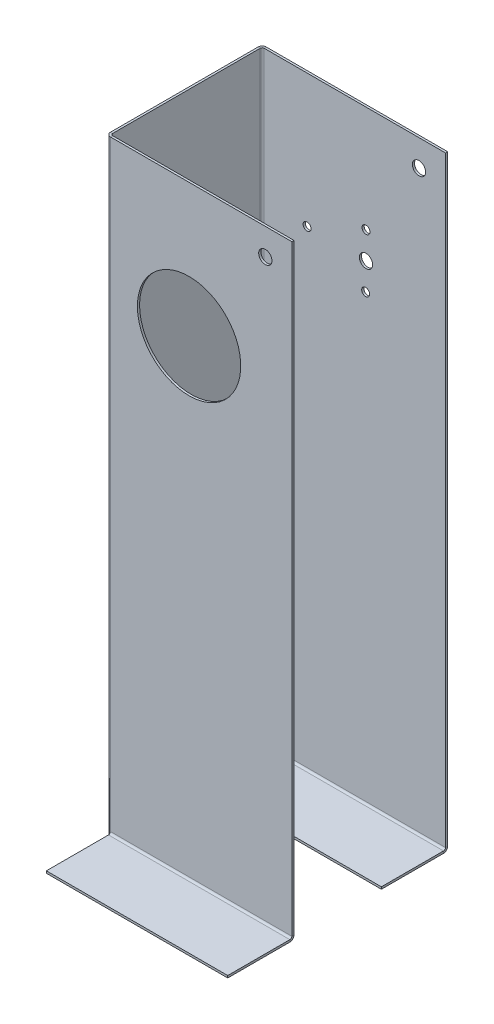
from build123d import *

# Parameters (mm, degrees)
SKETCH1_W                      = 70
SKETCH1_H                      = 228.6
BASE_FLANGE1_DEPTH             = 0.81
EDGE_FLANGE1_STRIP_W           = 4.7132
EDGE_FLANGE1_STRIP_H           = 0.81
EDGE_FLANGE1_STRIP_CUT_DEPTH   = 228.6
EDGE_FLANGE1_DEPTH             = 228.6
EDGE_FLANGE2_STRIP_W           = 4.7132
EDGE_FLANGE2_STRIP_H           = 0.81
EDGE_FLANGE2_STRIP_CUT_DEPTH   = 228.6
EDGE_FLANGE2_DEPTH             = 228.6
EDGE_FLANGE3_STRIP_W           = 4.7132
EDGE_FLANGE3_STRIP_H           = 0.81
EDGE_FLANGE3_STRIP_CUT_DEPTH   = 68.4534
EDGE_FLANGE3_STRIP_2_W         = 4.7132
EDGE_FLANGE3_STRIP_2_H         = 0.81
EDGE_FLANGE3_STRIP_CUT_2_DEPTH = 68.4534
EDGE_FLANGE3_DEPTH             = 68.4534
EDGE_FLANGE3_BEND_DEPTH        = 68.4534
CUT_EXTRUDE2_REACH             = 255.075
SKETCH18_R                     = 2.5
SKETCH18_R_2                   = 1.5
CUT_EXTRUDE1_REACH             = 248.204
SKETCH17_R                     = 19.5
SKETCH17_R_2                   = 2.5


# Sheet-metal steps are written as plain solids
with BuildPart() as part:
    # Sketch1 → Base-Flange1 (new body)
    with BuildSketch(Plane.XY):
        with Locations((35, 114.3)):
            Rectangle(SKETCH1_W, SKETCH1_H)
    extrude(amount=-BASE_FLANGE1_DEPTH)

    # Edge-Flange1 strip (across the edge) → Edge-Flange1 strip cut (cut)
    with BuildSketch(Plane(origin=(0, 0, -0.81), x_dir=(1, 0, 0), z_dir=(0, 1, 0))):
        with Locations((-0.81, -0.405)):
            Rectangle(EDGE_FLANGE1_STRIP_W, EDGE_FLANGE1_STRIP_H)
    extrude(amount=EDGE_FLANGE1_STRIP_CUT_DEPTH, mode=Mode.SUBTRACT)

    # Edge-Flange1 section (across the edge) → Edge-Flange1 (add)
    with BuildSketch(Plane(origin=(0, 0, -0.81), x_dir=(1, 0, 0), z_dir=(0, 1, 0))):
        with BuildLine():
            Line((0, 0.7366), (0, 58))
            Line((0, 58), (0.81, 58))
            Line((0.81, 58), (0.81, 0.7366))
            ThreePointArc((0.81, 0.7366), (1.025745145, 0.215745145), (1.5466, 0))
            Line((1.5466, 0), (1.5466, -0.81))
            ThreePointArc((1.5466, -0.81), (0.452988652, -0.357011348), (0, 0.7366))
        make_face()
    extrude(amount=EDGE_FLANGE1_DEPTH)

    # Edge-Flange2 strip (across the edge) → Edge-Flange2 strip cut (cut)
    with BuildSketch(Plane(origin=(0.81, 0, -58.81), x_dir=(0, 0, 1), z_dir=(0, 1, 0))):
        with Locations((-0.81, -0.405)):
            Rectangle(EDGE_FLANGE2_STRIP_W, EDGE_FLANGE2_STRIP_H)
    extrude(amount=EDGE_FLANGE2_STRIP_CUT_DEPTH, mode=Mode.SUBTRACT)

    # Edge-Flange2 section (across the edge) → Edge-Flange2 (add)
    with BuildSketch(Plane(origin=(0.81, 0, -58.81), x_dir=(0, 0, 1), z_dir=(0, 1, 0))):
        with BuildLine():
            Line((0, 0.7366), (0, 69.19))
            Line((0, 69.19), (0.81, 69.19))
            Line((0.81, 69.19), (0.81, 0.7366))
            ThreePointArc((0.81, 0.7366), (1.025745145, 0.215745145), (1.5466, 0))
            Line((1.5466, 0), (1.5466, -0.81))
            ThreePointArc((1.5466, -0.81), (0.452988652, -0.357011348), (0, 0.7366))
        make_face()
    extrude(amount=EDGE_FLANGE2_DEPTH)

    # Edge-Flange3 strip (across the edge) → Edge-Flange3 strip cut (cut)
    with BuildSketch(Plane.YZ.offset(1.5466)):
        with Locations((-0.81, -0.405)):
            Rectangle(EDGE_FLANGE3_STRIP_W, EDGE_FLANGE3_STRIP_H)
    extrude(amount=EDGE_FLANGE3_STRIP_CUT_DEPTH, mode=Mode.SUBTRACT)

    # Edge-Flange3 strip 2 (across the edge) → Edge-Flange3 strip cut 2 (cut)
    with BuildSketch(Plane(origin=(1.5466, 0, -58), x_dir=(0, 1, 0), z_dir=(1, 0, 0))):
        with Locations((-0.81, -0.405)):
            Rectangle(EDGE_FLANGE3_STRIP_2_W, EDGE_FLANGE3_STRIP_2_H)
    extrude(amount=EDGE_FLANGE3_STRIP_CUT_2_DEPTH, mode=Mode.SUBTRACT)

    # Edge-Flange3 section (across the edge) → Edge-Flange3 (add)
    with BuildSketch(Plane.YZ.offset(1.5466)):
        with BuildLine():
            Line((0, 0.7366), (0, 24.19))
            Line((0, 24.19), (0.81, 24.19))
            Line((0.81, 24.19), (0.81, 0.7366))
            ThreePointArc((0.81, 0.7366), (1.025745145, 0.215745145), (1.5466, 0))
            Line((1.5466, 0), (1.5466, -0.81))
            ThreePointArc((1.5466, -0.81), (0.452988652, -0.357011348), (0, 0.7366))
        make_face()
    extrude(amount=EDGE_FLANGE3_DEPTH)

    # Edge-Flange3 section 2 (across the edge) → Edge-Flange3 bend (add)
    with BuildSketch(Plane(origin=(1.5466, 0, -58), x_dir=(0, 1, 0), z_dir=(1, 0, 0))):
        with BuildLine():
            Line((0, 0.7366), (0, 24.19))
            Line((0, 24.19), (0.81, 24.19))
            Line((0.81, 24.19), (0.81, 0.7366))
            ThreePointArc((0.81, 0.7366), (1.025745145, 0.215745145), (1.5466, 0))
            Line((1.5466, 0), (1.5466, -0.81))
            ThreePointArc((1.5466, -0.81), (0.452988652, -0.357011348), (0, 0.7366))
        make_face()
    extrude(amount=EDGE_FLANGE3_BEND_DEPTH)

    # Sketch18 → Cut-Extrude2 (cut, up to next)
    with BuildSketch(Plane.XY.offset(-58.81), mode=Mode.PRIVATE) as cut_extrude2_sk1:
        with Locations(Location((40, 178.288711259, 0), (0, 0, 180))):
            Circle(SKETCH18_R)
    cut_extrude2_tool1 = extrude(cut_extrude2_sk1.sketch, amount=CUT_EXTRUDE2_REACH, mode=Mode.PRIVATE) & part.part
    # Sketch18 → Cut-Extrude2 (cut, up to next)
    with BuildSketch(Plane.XY.offset(-58.81), mode=Mode.PRIVATE) as cut_extrude2_sk2:
        with Locations(Location((60, 218.6, 0), (0, 0, 180))):
            Circle(SKETCH18_R)
    cut_extrude2_tool2 = extrude(cut_extrude2_sk2.sketch, amount=CUT_EXTRUDE2_REACH, mode=Mode.PRIVATE) & part.part
    # Sketch18 → Cut-Extrude2 (cut, up to next)
    with BuildSketch(Plane.XY.offset(-58.81), mode=Mode.PRIVATE) as cut_extrude2_sk3:
        with Locations(Location((39.883110044, 168.078078525, 0), (0, 0, 180))):
            Circle(SKETCH18_R_2)
    cut_extrude2_tool3 = extrude(cut_extrude2_sk3.sketch, amount=CUT_EXTRUDE2_REACH, mode=Mode.PRIVATE) & part.part
    # Sketch18 → Cut-Extrude2 (cut, up to next)
    with BuildSketch(Plane.XY.offset(-58.81), mode=Mode.PRIVATE) as cut_extrude2_sk4:
        with Locations(Location((40, 188.499343992, 0), (0, 0, 180))):
            Circle(SKETCH18_R_2)
    cut_extrude2_tool4 = extrude(cut_extrude2_sk4.sketch, amount=CUT_EXTRUDE2_REACH, mode=Mode.PRIVATE) & part.part
    # Sketch18 → Cut-Extrude2 (cut, up to next)
    with BuildSketch(Plane.XY.offset(-58.81), mode=Mode.PRIVATE) as cut_extrude2_sk5:
        with Locations(Location((17.767718264, 178.415632815, 0), (0, 0, 180))):
            Circle(SKETCH18_R_2)
    cut_extrude2_tool5 = extrude(cut_extrude2_sk5.sketch, amount=CUT_EXTRUDE2_REACH, mode=Mode.PRIVATE) & part.part
    add(cut_extrude2_tool1.solids().sort_by_distance((40, 178.288711, -58.81))[0], mode=Mode.SUBTRACT)
    add(cut_extrude2_tool2.solids().sort_by_distance((60, 218.6, -58.81))[0], mode=Mode.SUBTRACT)
    add(cut_extrude2_tool3.solids().sort_by_distance((39.88311, 168.078079, -58.81))[0], mode=Mode.SUBTRACT)
    add(cut_extrude2_tool4.solids().sort_by_distance((40, 188.499344, -58.81))[0], mode=Mode.SUBTRACT)
    add(cut_extrude2_tool5.solids().sort_by_distance((17.767718, 178.415633, -58.81))[0], mode=Mode.SUBTRACT)

    # Sketch17 → Cut-Extrude1 (cut, up to next)
    with BuildSketch(Plane(origin=(0, 0, 0), x_dir=(-1, 0, 0), z_dir=(0, 0, -1)), mode=Mode.PRIVATE) as cut_extrude1_sk1:
        with Locations((-31.22013265, 178.33917696)):
            Circle(SKETCH17_R)
    cut_extrude1_tool1 = extrude(cut_extrude1_sk1.sketch, amount=CUT_EXTRUDE1_REACH, mode=Mode.PRIVATE) & part.part
    # Sketch17 → Cut-Extrude1 (cut, up to next)
    with BuildSketch(Plane(origin=(0, 0, 0), x_dir=(-1, 0, 0), z_dir=(0, 0, -1)), mode=Mode.PRIVATE) as cut_extrude1_sk2:
        with Locations((-60, 218.6)):
            Circle(SKETCH17_R_2)
    cut_extrude1_tool2 = extrude(cut_extrude1_sk2.sketch, amount=CUT_EXTRUDE1_REACH, mode=Mode.PRIVATE) & part.part
    add(cut_extrude1_tool1.solids().sort_by_distance((31.220133, 178.339177, 0))[0], mode=Mode.SUBTRACT)
    add(cut_extrude1_tool2.solids().sort_by_distance((60, 218.6, 0))[0], mode=Mode.SUBTRACT)


solid = part.part
